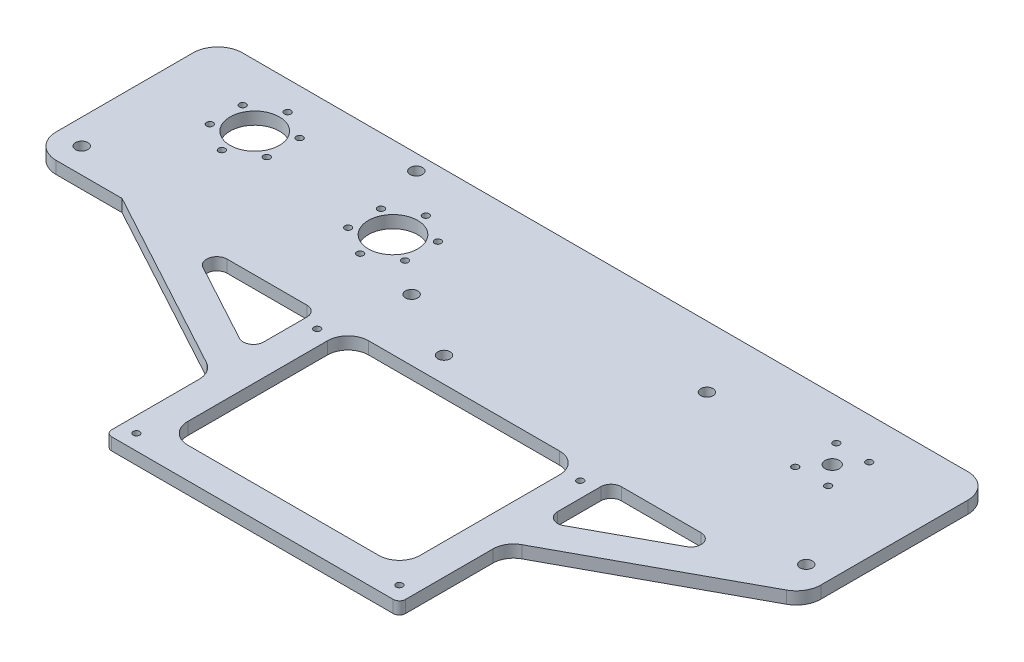
from build123d import *

# Parameters (mm, degrees)
ESBO_O1_R                = 1.6
ESBO_O1_R_2              = 3
ESBO_O1_R_3              = 12
ESBO_O1_R_4              = 3.5
RESSALTO_EXTRUS_O1_DEPTH = 6


with BuildPart() as part:
    # Esboço1 → Ressalto-extrusão1 (new body)
    with BuildSketch(Plane(origin=(0, 0, 0), x_dir=(1, 0, 0), z_dir=(0, 1, 0))):
        with BuildLine():
            Line((-46.472077044, -153.648697641), (90.527922956, -153.648697641))
            ThreePointArc((90.527922956, -153.648697641), (92.649243299, -152.770017984), (93.527922956, -150.648697641))
            Line((93.527922956, -150.648697641), (93.527922956, -108.102521344))
            ThreePointArc((93.527922956, -108.102521344), (94.935539012, -102.986767425), (98.762110588, -99.311216977))
            Line((98.762110588, -99.311216977), (182.246897797, -54.053674438))
            ThreePointArc((182.246897797, -54.053674438), (186.838783688, -49.6430139), (188.527922956, -43.504109197))
            Line((188.527922956, -43.504109197), (188.527922956, 28))
            ThreePointArc((188.527922956, 28), (185.01320433, 36.485281374), (176.527922956, 40))
            Line((176.527922956, 40), (-176.527922956, 40))
            ThreePointArc((-176.527922956, 40), (-185.01320433, 36.485281374), (-188.527922956, 28))
            Line((-188.527922956, 28), (-188.527922956, -38.648697641))
            ThreePointArc((-188.527922956, -38.648697641), (-185.01320433, -47.133979015), (-176.527922956, -50.648697641))
            Line((-176.527922956, -50.648697641), (-144.472077044, -50.648697641))
            Line((-144.472077044, -50.648697641), (-54.706264677, -99.311216977))
            ThreePointArc((-54.706264677, -99.311216977), (-50.8796931, -102.986767425), (-49.472077044, -108.102521344))
            Line((-49.472077044, -108.102521344), (-49.472077044, -150.648697641))
            ThreePointArc((-49.472077044, -150.648697641), (-48.593397388, -152.770017984), (-46.472077044, -153.648697641))
        make_face()
        with Locations((-41.972077044, -58.148697641)):
            Circle(ESBO_O1_R, mode=Mode.SUBTRACT)
        with Locations((-41.972077044, -146.148697641)):
            Circle(ESBO_O1_R, mode=Mode.SUBTRACT)
        with Locations((86.027922956, -58.148697641)):
            Circle(ESBO_O1_R, mode=Mode.SUBTRACT)
        with Locations((86.027922956, -146.148697641)):
            Circle(ESBO_O1_R, mode=Mode.SUBTRACT)
        with Locations((176.311042956, -38.431817641)):
            Circle(ESBO_O1_R_2, mode=Mode.SUBTRACT)
        with Locations((0, -38.431817641)):
            Circle(ESBO_O1_R_2, mode=Mode.SUBTRACT)
        with Locations((-140.527922956, 10)):
            Circle(ESBO_O1_R_3, mode=Mode.SUBTRACT)
        with Locations((-140.527922956, -6)):
            Circle(ESBO_O1_R, mode=Mode.SUBTRACT)
        with Locations((-154.384329416, 2)):
            Circle(ESBO_O1_R, mode=Mode.SUBTRACT)
        with Locations((-154.384329416, 18)):
            Circle(ESBO_O1_R, mode=Mode.SUBTRACT)
        with Locations((-84.367438628, 32.5)):
            Circle(ESBO_O1_R_2, mode=Mode.SUBTRACT)
        with Locations((-176.311042956, -38.431817641)):
            Circle(ESBO_O1_R_2, mode=Mode.SUBTRACT)
        with Locations((140.527922956, 10)):
            Circle(ESBO_O1_R_4, mode=Mode.SUBTRACT)
        with Locations((148.527922956, 0)):
            Circle(ESBO_O1_R, mode=Mode.SUBTRACT)
        with Locations((148.527922956, 20)):
            Circle(ESBO_O1_R, mode=Mode.SUBTRACT)
        with Locations((132.527922956, 0)):
            Circle(ESBO_O1_R, mode=Mode.SUBTRACT)
        with Locations((132.527922956, 20)):
            Circle(ESBO_O1_R, mode=Mode.SUBTRACT)
        with Locations((-140.527922956, 26)):
            Circle(ESBO_O1_R, mode=Mode.SUBTRACT)
        with Locations((-126.671516495, 18)):
            Circle(ESBO_O1_R, mode=Mode.SUBTRACT)
        with Locations((-126.671516495, 2)):
            Circle(ESBO_O1_R, mode=Mode.SUBTRACT)
        with Locations((-63.240442956, -16)):
            Circle(ESBO_O1_R, mode=Mode.SUBTRACT)
        with Locations((-77.096849416, -8)):
            Circle(ESBO_O1_R, mode=Mode.SUBTRACT)
        with Locations((-77.096849416, 8)):
            Circle(ESBO_O1_R, mode=Mode.SUBTRACT)
        with Locations((-63.240442956, 16)):
            Circle(ESBO_O1_R, mode=Mode.SUBTRACT)
        with Locations((-49.384036495, 8)):
            Circle(ESBO_O1_R, mode=Mode.SUBTRACT)
        with Locations((-49.384036495, -8)):
            Circle(ESBO_O1_R, mode=Mode.SUBTRACT)
        with Locations((-63.240442956, 0)):
            Circle(ESBO_O1_R_3, mode=Mode.SUBTRACT)
        with Locations((-33.527922956, -20.648697641)):
            Circle(ESBO_O1_R_2, mode=Mode.SUBTRACT)
        with Locations((79.527922956, 10)):
            Circle(ESBO_O1_R_2, mode=Mode.SUBTRACT)
        with BuildLine():
            Line((98.527922956, -50.648697641), (137.339058808, -50.648697641))
            ThreePointArc((137.339058808, -50.648697641), (142.185617428, -54.419523308), (139.721964992, -60.044349825))
            Line((139.721964992, -60.044349825), (100.91082914, -81.084070839))
            ThreePointArc((100.91082914, -81.084070839), (95.970045996, -80.984610627), (93.527922956, -76.688418655))
            Line((93.527922956, -76.688418655), (93.527922956, -55.648697641))
            ThreePointArc((93.527922956, -55.648697641), (94.99238905, -52.113163735), (98.527922956, -50.648697641))
        make_face(mode=Mode.SUBTRACT)
        with BuildLine():
            Line((-93.283212896, -50.648697641), (-54.472077044, -50.648697641))
            ThreePointArc((-54.472077044, -50.648697641), (-50.936543138, -52.113163735), (-49.472077044, -55.648697641))
            Line((-49.472077044, -55.648697641), (-49.472077044, -76.688418655))
            ThreePointArc((-49.472077044, -76.688418655), (-51.914200084, -80.984610627), (-56.854983228, -81.084070839))
            Line((-56.854983228, -81.084070839), (-95.66611908, -60.044349825))
            ThreePointArc((-95.66611908, -60.044349825), (-98.129771516, -54.419523308), (-93.283212896, -50.648697641))
        make_face(mode=Mode.SUBTRACT)
        with BuildLine():
            Line((78.527922956, -60.648697641), (78.527922956, -128.648697641))
            ThreePointArc((78.527922956, -128.648697641), (75.598990768, -135.719765453), (68.527922956, -138.648697641))
            Line((68.527922956, -138.648697641), (-24.472077044, -138.648697641))
            ThreePointArc((-24.472077044, -138.648697641), (-31.543144856, -135.719765453), (-34.472077044, -128.648697641))
            Line((-34.472077044, -128.648697641), (-34.472077044, -60.648697641))
            ThreePointArc((-34.472077044, -60.648697641), (-31.543144856, -53.577629829), (-24.472077044, -50.648697641))
            Line((-24.472077044, -50.648697641), (68.527922956, -50.648697641))
            ThreePointArc((68.527922956, -50.648697641), (75.598990768, -53.577629829), (78.527922956, -60.648697641))
        make_face(mode=Mode.SUBTRACT)
    extrude(amount=-RESSALTO_EXTRUS_O1_DEPTH)


solid = part.part
